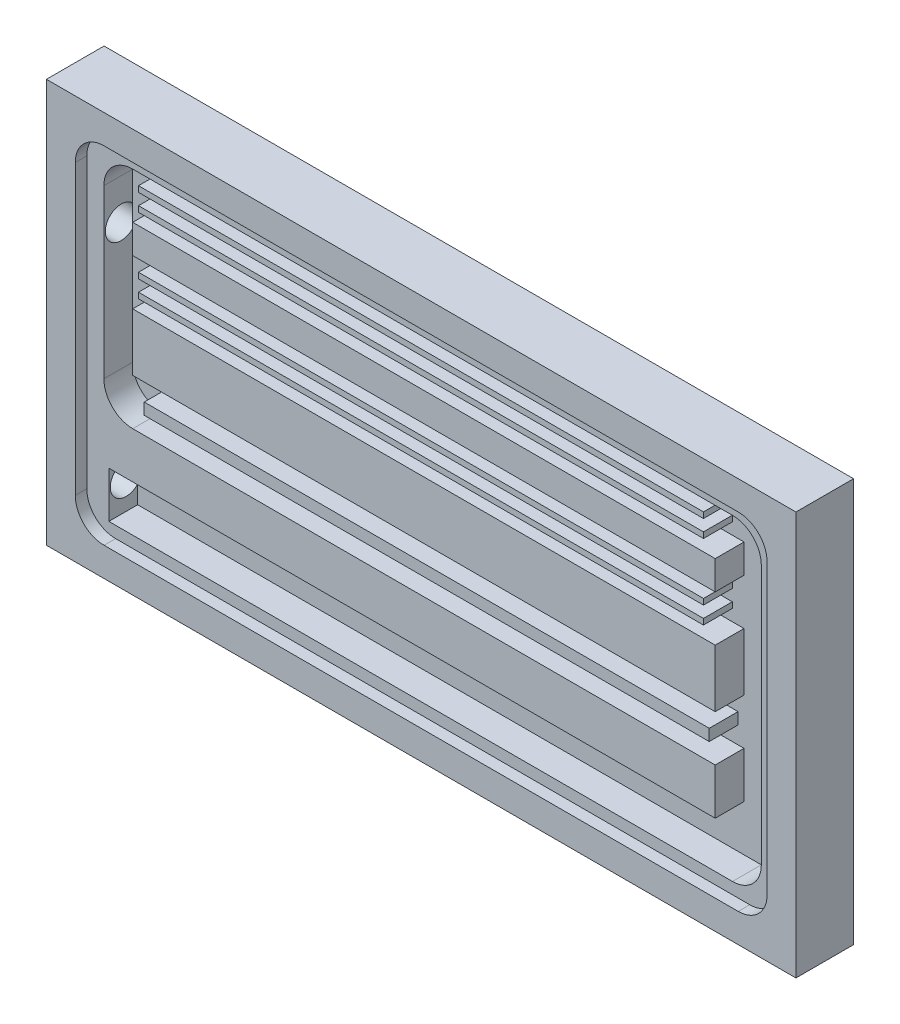
from build123d import *

# Parameters (mm, degrees)
ESQUISSE1_W                                 = 130
ESQUISSE1_H                                 = 70
BOSS_EXTRU_1_DEPTH                          = 10
ENL_V_MAT_EXTRU_1_DEPTH                     = 2
ESQUISSE20_W                                = 101.033933646
ESQUISSE20_H                                = 5
ESQUISSE20_H_2                              = 10
ENL_V_MAT_EXTRU_3_DEPTH                     = 5
CHAMBRAGE_POUR_VIS_SIX_PANS_CREUX_2_R       = 2.75
CHAMBRAGE_POUR_VIS_SIX_PANS_CREUX_M52_DEPTH = 7.966066354
CHAMBRAGE_POUR_VIS_SIX_PANS_CREUX_3_OU_R    = 4
CHAMBRAGE_POUR_VIS_SIX_PANS_CREUX_3_OU_R_2  = 2.75
CHAMBRAGE_POUR_VIS_SIX_PANS_CREUX_3_DEPTH   = 2
CHAMBRAGE_START                             = 7.966066354
CHAMBRAGE_POUR_VIS_SIX_PANS_CREUX_4_OU_R    = 2.75
CHAMBRAGE_POUR_VIS_SIX_PANS_CREUX_4_DEPTH   = 0.858319246
ESQUISSE23_W                                = 98
ESQUISSE23_H                                = 1
ESQUISSE23_H_2                              = 2
BOSS_EXTRU_2_DEPTH                          = 5


# Read off the part's stored shape, not the designer's step: Chambrage pour vis à six pans creux M52
with BuildPart() as part:
    # Esquisse1 → Boss.-Extru.1 (new body)
    with BuildSketch(Plane.XY):
        with Locations((65, 35)):
            Rectangle(ESQUISSE1_W, ESQUISSE1_H)
    extrude(amount=BOSS_EXTRU_1_DEPTH)

    # Esquisse18 → Enlèv. mat.-Extru.1 (cut)
    with BuildSketch(Plane.XY.offset(10)):
        with BuildLine():
            Line((10, 5), (120, 5))
            ThreePointArc((120, 5), (123.535533906, 6.464466094), (125, 10))
            Line((125, 10), (125, 60))
            ThreePointArc((125, 60), (123.535533906, 63.535533906), (120, 65))
            Line((120, 65), (10, 65))
            ThreePointArc((10, 65), (6.464466094, 63.535533906), (5, 60))
            Line((5, 60), (5, 10))
            ThreePointArc((5, 10), (6.464466094, 6.464466094), (10, 5))
        make_face()
    extrude(amount=-ENL_V_MAT_EXTRU_1_DEPTH, mode=Mode.SUBTRACT)

    # Esquisse20 → Enlèv. mat.-Extru.3 (cut)
    with BuildSketch(Plane.XY.offset(8)):
        with BuildLine():
            Line((12.966066354, 62), (117, 62))
            ThreePointArc((117, 62), (120.535533906, 60.535533906), (122, 57))
            Line((122, 57), (122, 12))
            ThreePointArc((122, 12), (120.535533906, 8.464466094), (117, 7))
            Line((117, 7), (8.8243856, 7))
            Line((8.8243856, 7), (8.8243856, 15))
            Line((8.8243856, 15), (114, 15))
            Line((114, 15), (114, 23))
            Line((114, 23), (12.966066354, 23))
            ThreePointArc((12.966066354, 23), (9.430532448, 24.464466094), (7.966066354, 28))
            Line((7.966066354, 28), (7.966066354, 57))
            ThreePointArc((7.966066354, 57), (9.430532448, 60.535533906), (12.966066354, 62))
        make_face()
        with Locations((63.483033177, 51.5)):
            Rectangle(ESQUISSE20_W, ESQUISSE20_H, mode=Mode.SUBTRACT)
        with Locations((63.483033177, 36)):
            Rectangle(ESQUISSE20_W, ESQUISSE20_H_2, mode=Mode.SUBTRACT)
    extrude(amount=-ENL_V_MAT_EXTRU_3_DEPTH, mode=Mode.SUBTRACT)

    # Chambrage pour vis _ six pans creux  2 → Chambrage pour vis à six pans creux M52 (cut)
    with BuildSketch(Plane.YZ):
        with Locations((12, 5)):
            Circle(CHAMBRAGE_POUR_VIS_SIX_PANS_CREUX_2_R)
        with Locations((50, 5)):
            Circle(CHAMBRAGE_POUR_VIS_SIX_PANS_CREUX_2_R)
    extrude(amount=CHAMBRAGE_POUR_VIS_SIX_PANS_CREUX_M52_DEPTH, mode=Mode.SUBTRACT)

    # Chambrage pour vis _ six pans creux 3 ou → Chambrage pour vis _ six pans creux  3 (cut)
    # profile 1 of 2: a face of its own
    with BuildSketch(Plane.YZ):
        with Locations((12, 5)):
            Circle(CHAMBRAGE_POUR_VIS_SIX_PANS_CREUX_3_OU_R)
        with Locations((12, 5)):
            Circle(CHAMBRAGE_POUR_VIS_SIX_PANS_CREUX_3_OU_R_2, mode=Mode.SUBTRACT)
    # profile 2 of 2: a face of its own
    with BuildSketch(Plane.YZ):
        with Locations((50, 5)):
            Circle(CHAMBRAGE_POUR_VIS_SIX_PANS_CREUX_3_OU_R)
        with Locations((50, 5)):
            Circle(CHAMBRAGE_POUR_VIS_SIX_PANS_CREUX_3_OU_R_2, mode=Mode.SUBTRACT)
    extrude(amount=CHAMBRAGE_POUR_VIS_SIX_PANS_CREUX_3_DEPTH, mode=Mode.SUBTRACT)

    # Chambrage pour vis _ six pans creux 4 ou → Chambrage pour vis _ six pans creux  4 (cut)
    with BuildSketch(Plane.YZ.offset(CHAMBRAGE_START)):
        with Locations((12, 5)):
            Circle(CHAMBRAGE_POUR_VIS_SIX_PANS_CREUX_4_OU_R)
    extrude(amount=CHAMBRAGE_POUR_VIS_SIX_PANS_CREUX_4_DEPTH, mode=Mode.SUBTRACT)

    # Esquisse23 → Boss.-Extru.2 (add)
    with BuildSketch(Plane.XY.offset(3)):
        with Locations((62.966066354, 59.5)):
            Rectangle(ESQUISSE23_W, ESQUISSE23_H)
        with Locations((62.966066354, 56.5)):
            Rectangle(ESQUISSE23_W, ESQUISSE23_H)
        with Locations((62.966066354, 46.5)):
            Rectangle(ESQUISSE23_W, ESQUISSE23_H)
        with Locations((62.966066354, 43.5)):
            Rectangle(ESQUISSE23_W, ESQUISSE23_H)
        with Locations((63.966066354, 27)):
            Rectangle(ESQUISSE23_W, ESQUISSE23_H_2)
    extrude(amount=BOSS_EXTRU_2_DEPTH)


solid = part.part
